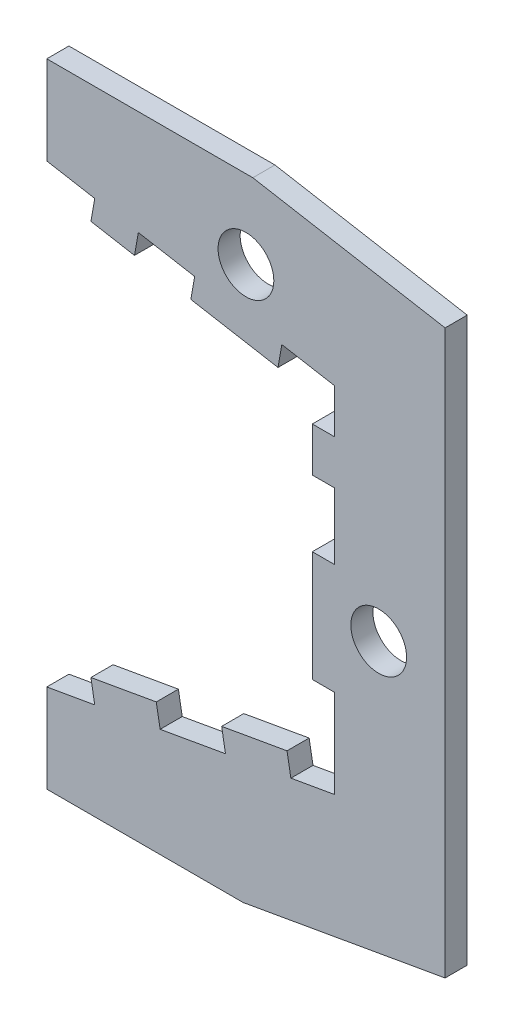
from build123d import *

# Parameters (mm, degrees)
ESQUISSE1_R        = 6.3
BOSS_EXTRU_1_DEPTH = 5
ESQUISSE4_W        = 5
ESQUISSE4_H        = 25
ESQUISSE4_H_2      = 10
BOSS_EXTRU_2_DEPTH = 5


with BuildPart() as part:
    # Esquisse1 → Boss.-Extru.1 (new body)
    with BuildSketch(Plane.XY):
        Polygon((-65, 51.461253746), (0, 40), (0, -40), (-65, -51.461253746), (-65, -71.461253746), (-20.625899742, -71.461253746), (25, -63.416176602), (25, 63.800831685), (-18.444412366, 71.461253746), (-65, 71.461253746), align=None)
        with Locations((-20, 53.680805733)):
            Circle(ESQUISSE1_R, mode=Mode.SUBTRACT)
        with Locations((10, -5)):
            Circle(ESQUISSE1_R, mode=Mode.SUBTRACT)
    extrude(amount=BOSS_EXTRU_1_DEPTH)

    # Esquisse4 → Boss.-Extru.2 (add)
    with BuildSketch(Plane.XY.offset(5)):
        with Locations((-2.5, -7.5)):
            Rectangle(ESQUISSE4_W, ESQUISSE4_H)
        Polygon((-11.888404247, 42.096246426), (-31.584559307, 45.56920998), (-32.452800195, 40.645171215), (-12.756645135, 37.172207661), align=None)
        Polygon((-9.84807753, -41.736481777), (-24.620193825, -44.341204442), (-25.488434714, -39.417165677), (-10.716318418, -36.812443012), align=None)
        with Locations((-2.5, 25)):
            Rectangle(ESQUISSE4_W, ESQUISSE4_H_2)
        Polygon((-54.164426416, -49.550649772), (-39.39231012, -46.945927107), (-40.260551009, -42.021888342), (-55.032667304, -44.626611007), align=None)
        Polygon((-44.316348886, 47.814167995), (-54.164426416, 49.550649772), (-55.032667304, 44.626611007), (-45.184589774, 42.89012923), align=None)
    extrude(amount=-BOSS_EXTRU_2_DEPTH)


solid = part.part
